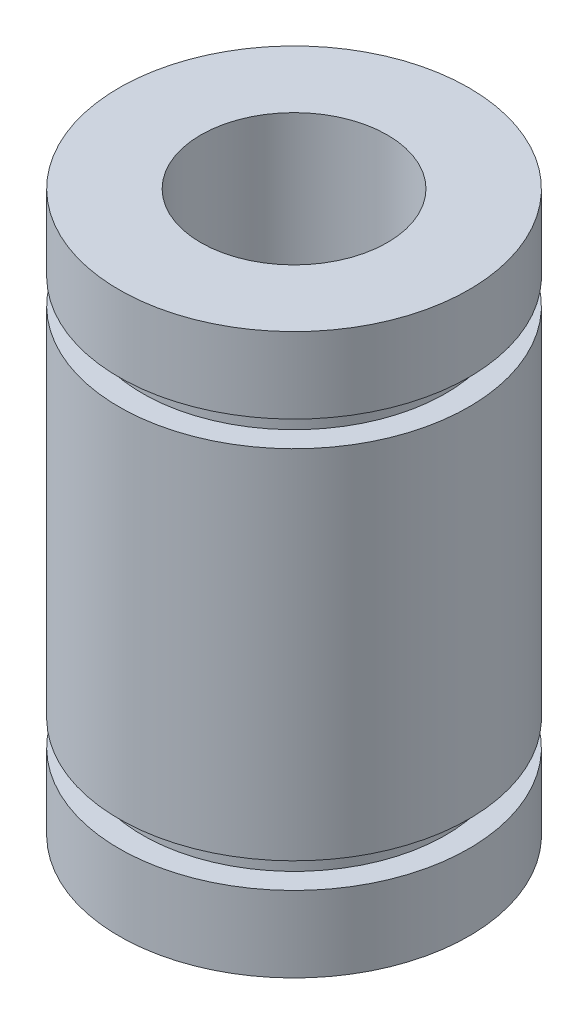
from build123d import *


with BuildPart() as part:
    # Sketch1 → Revolve1 (revolve)
    with BuildSketch(Plane.XY):
        Polygon((4, 0), (4, 12), (7.5, 12), (7.5, 8.75), (6.5, 8.75), (6.5, 7.65), (7.5, 7.65), (7.5, 0), align=None)
    revolve1 = revolve(axis=Axis((0, 0, 0), (0, 1, 0)))

    # Mirror1: Revolve1 across plane
    add(revolve1.mirror(Plane(origin=(4, 0, 0), x_dir=(0, 0, 1), z_dir=(0, -1, 0))))


solid = part.part
